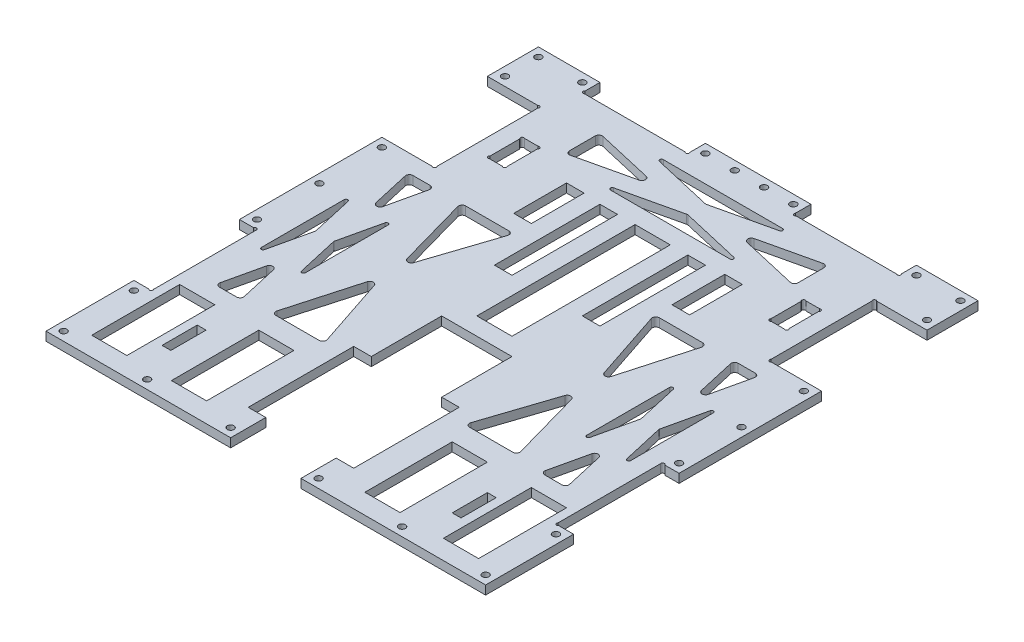
from build123d import *

# Parameters (mm, degrees)
SKETCH1_W           = 317.5
SKETCH1_H           = 355.6
BOSS_EXTRUDE1_DEPTH = 6.35
SKETCH2_W           = 50.8
SKETCH2_H           = 152.4
CUT_EXTRUDE1_DEPTH  = 239.442288615
SKETCH3_W           = 25.4
SKETCH3_H           = 76.2
SKETCH3_W_2         = 12.7
SKETCH3_H_2         = 25.4
CUT_EXTRUDE2_DEPTH  = 239.442288615
SKETCH4_W           = 12.7
SKETCH4_H           = 76.2
SKETCH4_W_2         = 76.2
SKETCH4_H_2         = 12.7
CUT_EXTRUDE3_DEPTH  = 239.442288615
SKETCH5_W           = 25.4
SKETCH5_H           = 63.089423232
SKETCH5_H_2         = 114.3
SKETCH5_W_2         = 12.7
SKETCH5_H_3         = 38.1
SKETCH5_H_4         = 63.5
SKETCH5_W_3         = 6.35
SKETCH5_H_5         = 25.4
CUT_EXTRUDE4_DEPTH  = 239.442288615
SKETCH7_R           = 2.413
CUT_EXTRUDE6_DEPTH  = 239.442288615
SKETCH8_R           = 1.27
CUT_EXTRUDE7_DEPTH  = 239.442288615
FILLET1_R           = 1.27
FILLET2_R           = 2.54


with BuildPart() as part:
    # Sketch1 → Boss-Extrude1 (new body)
    with BuildSketch(Plane(origin=(0, 0, 0), x_dir=(1, 0, 0), z_dir=(0, 1, 0))):
        Rectangle(SKETCH1_W, SKETCH1_H)
    extrude(amount=BOSS_EXTRUDE1_DEPTH)

    # Sketch2 → Cut-Extrude1 (cut, through all)
    with BuildSketch(Plane(origin=(0, 6.35, 0), x_dir=(1, 0, 0), z_dir=(0, 1, 0))):
        with Locations((0, -101.6)):
            Rectangle(SKETCH2_W, SKETCH2_H)
    extrude(amount=-CUT_EXTRUDE1_DEPTH, mode=Mode.SUBTRACT)

    # Sketch3 → Cut-Extrude2 (cut, through all)
    with BuildSketch(Plane(origin=(0, 6.35, 0), x_dir=(1, 0, 0), z_dir=(0, 1, 0))):
        with Locations((133.35, 102.87)):
            Rectangle(SKETCH3_W, SKETCH3_H)
        with Locations((101.6, 102.87)):
            Rectangle(SKETCH3_W_2, SKETCH3_H_2)
        with Locations((-101.6, 102.87)):
            Rectangle(SKETCH3_W_2, SKETCH3_H_2)
        with Locations((-133.35, 102.87)):
            Rectangle(SKETCH3_W, SKETCH3_H)
    extrude(amount=-CUT_EXTRUDE2_DEPTH, mode=Mode.SUBTRACT)

    # Sketch4 → Cut-Extrude3 (cut, through all)
    with BuildSketch(Plane(origin=(0, 6.35, 0), x_dir=(1, 0, 0), z_dir=(0, 1, 0))):
        with Locations((-152.4, 102.87)):
            Rectangle(SKETCH4_W, SKETCH4_H)
        with Locations((-152.4, -76.2)):
            Rectangle(SKETCH4_W, SKETCH4_H)
        with Locations((152.4, 102.87)):
            Rectangle(SKETCH4_W, SKETCH4_H)
        with Locations((152.4, -76.2)):
            Rectangle(SKETCH4_W, SKETCH4_H)
        with Locations((76.2, 171.45)):
            Rectangle(SKETCH4_W_2, SKETCH4_H_2)
        with Locations((-76.2, 171.45)):
            Rectangle(SKETCH4_W_2, SKETCH4_H_2)
        with Locations((-31.75, -114.3)):
            Rectangle(SKETCH4_W, SKETCH4_H)
        with Locations((31.75, 63.5)):
            Rectangle(SKETCH4_W, SKETCH4_H)
        with Locations((-31.75, 63.5)):
            Rectangle(SKETCH4_W, SKETCH4_H)
        with Locations((31.75, -114.3)):
            Rectangle(SKETCH4_W, SKETCH4_H)
    extrude(amount=-CUT_EXTRUDE3_DEPTH, mode=Mode.SUBTRACT)

    # Sketch5 → Cut-Extrude4 (cut, through all)
    with BuildSketch(Plane(origin=(0, 6.35, 0), x_dir=(1, 0, 0), z_dir=(0, 1, 0))):
        with Locations((-69.85, -131.874711616)):
            Rectangle(SKETCH5_W, SKETCH5_H)
        Polygon((-117.475, -46.432505999), (-126.838066818, -87.63), (-108.111933182, -87.63), align=None)
        Polygon((-133.35, 23.417494001), (-133.35, -58.977494001), (-123.986933182, -17.78), align=None)
        Polygon((-101.6, 23.417494001), (-110.963066818, -17.78), (-101.6, -58.977494001), align=None)
        Polygon((-126.838066818, 52.07), (-117.475, 10.872505999), (-108.111933182, 52.07), align=None)
        Polygon((0, 126.833110246), (-54.310144398, 114.3), (54.310144398, 114.3), align=None)
        Polygon((-82.55, 145.883110246), (-82.55, 120.816889754), (-28.239855602, 133.35), align=None)
        Polygon((82.55, 145.883110246), (28.239855602, 133.35), (82.55, 120.816889754), align=None)
        Polygon((-54.310144398, 152.4), (0, 139.866889754), (54.310144398, 152.4), align=None)
        with Locations((0, 44.45)):
            Rectangle(SKETCH5_W, SKETCH5_H_2)
        with Locations((-57.15, 83.82)):
            Rectangle(SKETCH5_W_2, SKETCH5_H_3)
        with Locations((57.15, 83.82)):
            Rectangle(SKETCH5_W_2, SKETCH5_H_3)
        with Locations((-127, -132.08)):
            Rectangle(SKETCH5_W, SKETCH5_H_4)
        Polygon((-71.4375, -22.791352996), (-88.9, -84.952705992), (-50.8, -84.952705992), align=None)
        with Locations((-104.775, -132.08)):
            Rectangle(SKETCH5_W_3, SKETCH5_H_5)
        Polygon((-50.8, 52.07), (-88.9, 52.07), (-71.4375, -10.091352996), align=None)
    cut_extrude4 = extrude(amount=-CUT_EXTRUDE4_DEPTH, mode=Mode.SUBTRACT)

    # Mirror1: Cut-Extrude4 across plane
    add(cut_extrude4.mirror(Plane(origin=(0, 0, 0), x_dir=(0, 0, 1), z_dir=(1, 0, 0))), mode=Mode.SUBTRACT)

    # Sketch7 → Cut-Extrude6 (cut, through all)
    with BuildSketch(Plane(origin=(0, 6.35, 0), x_dir=(1, 0, 0), z_dir=(0, 1, 0))):
        with Locations((-152.4, -171.45)):
            Circle(SKETCH7_R)
        with Locations((-152.4, 171.45)):
            Circle(SKETCH7_R)
        with Locations((-120.65, 171.45)):
            Circle(SKETCH7_R)
        with Locations((-152.4, 147.32)):
            Circle(SKETCH7_R)
        with Locations((-31.75, 171.45)):
            Circle(SKETCH7_R)
        with Locations((-10.583333333, 171.45)):
            Circle(SKETCH7_R)
        with Locations((10.583333333, 171.45)):
            Circle(SKETCH7_R)
        with Locations((31.75, 171.45)):
            Circle(SKETCH7_R)
        with Locations((-31.75, -171.45)):
            Circle(SKETCH7_R)
        with Locations((-92.075, -171.45)):
            Circle(SKETCH7_R)
        with Locations((-152.4, -120.65)):
            Circle(SKETCH7_R)
        with Locations((-152.4, -31.75)):
            Circle(SKETCH7_R)
        with Locations((-152.4, 58.42)):
            Circle(SKETCH7_R)
        with Locations((-152.4, 13.335)):
            Circle(SKETCH7_R)
        with Locations((31.75, -171.45)):
            Circle(SKETCH7_R)
        with Locations((152.4, 13.335)):
            Circle(SKETCH7_R)
        with Locations((152.4, 58.42)):
            Circle(SKETCH7_R)
        with Locations((152.4, -31.75)):
            Circle(SKETCH7_R)
        with Locations((152.4, -120.65)):
            Circle(SKETCH7_R)
        with Locations((92.075, -171.45)):
            Circle(SKETCH7_R)
        with Locations((152.4, 147.32)):
            Circle(SKETCH7_R)
        with Locations((120.65, 171.45)):
            Circle(SKETCH7_R)
        with Locations((152.4, 171.45)):
            Circle(SKETCH7_R)
        with Locations((152.4, -171.45)):
            Circle(SKETCH7_R)
    extrude(amount=-CUT_EXTRUDE6_DEPTH, mode=Mode.SUBTRACT)

    # Sketch8 → Cut-Extrude7 (cut, through all)
    with BuildSketch(Plane(origin=(0, 6.35, 0), x_dir=(1, 0, 0), z_dir=(0, 1, 0))):
        with Locations((-39.09938383, 165.88366572)):
            Circle(SKETCH8_R)
        with Locations((-113.539841326, 166.117378391)):
            Circle(SKETCH8_R)
        with Locations((-121.560019166, 140.084130304)):
            Circle(SKETCH8_R)
        with Locations((-121.565556473, 65.650145639)):
            Circle(SKETCH8_R)
        with Locations((-147.253032713, -38.506954901)):
            Circle(SKETCH8_R)
        with Locations((-147.044413998, -113.510037468)):
            Circle(SKETCH8_R)
        with Locations((-107.194291917, 114.549311364)):
            Circle(SKETCH8_R)
        with Locations((-96.034081321, 114.570942203)):
            Circle(SKETCH8_R)
        with Locations((-107.184450657, 91.18332828)):
            Circle(SKETCH8_R)
        with Locations((-96.208355861, 91.003339093)):
            Circle(SKETCH8_R)
    cut_extrude7 = extrude(amount=-CUT_EXTRUDE7_DEPTH, mode=Mode.SUBTRACT)

    # Mirror2: Cut-Extrude7 across plane
    add(cut_extrude7.mirror(Plane(origin=(0, 0, 0), x_dir=(0, 0, 1), z_dir=(1, 0, 0))), mode=Mode.SUBTRACT)

    # Fillet1
    fillet1_edges = [part.edges().sort_by_distance(p)[0] for p in [
        (-101.6, 3.175, 58.977494001),
        (-110.963066818, 3.175, 17.78),
        (-101.6, 3.175, -23.417494001),
        (-133.35, 3.175, -23.417494001),
        (-123.986933182, 3.175, 17.78),
        (-133.35, 3.175, 58.977494001),
        (133.35, 3.175, -23.417494001),
        (133.35, 3.175, 58.977494001),
        (123.986933182, 3.175, 17.78),
        (101.6, 3.175, -23.417494001),
        (110.963066818, 3.175, 17.78),
        (101.6, 3.175, 58.977494001),
        (54.310144398, 3.175, -152.4),
        (-54.310144398, 3.175, -152.4),
        (54.310144398, 3.175, -114.3),
        (-54.310144398, 3.175, -114.3),
    ]]
    fillet(fillet1_edges, radius=FILLET1_R)

    # Fillet2
    fillet2_edges = [part.edges().sort_by_distance(p)[0] for p in [
        (-126.838066818, 3.175, 87.63),
        (-108.111933182, 3.175, 87.63),
        (-117.475, 3.175, 46.432505999),
        (-28.239855602, 3.175, -133.35),
        (-82.55, 3.175, -120.816889754),
        (-82.55, 3.175, -145.883110246),
        (-88.9, 3.175, -52.07),
        (-71.4375, 3.175, 10.091352996),
        (-50.8, 3.175, -52.07),
        (-71.4375, 3.175, 22.791352996),
        (-88.9, 3.175, 84.952705992),
        (-50.8, 3.175, 84.952705992),
        (-126.838066818, 3.175, -52.07),
        (-117.475, 3.175, -10.872505999),
        (-108.111933182, 3.175, -52.07),
        (126.838066818, 3.175, 87.63),
        (108.111933182, 3.175, 87.63),
        (117.475, 3.175, 46.432505999),
        (88.9, 3.175, 84.952705992),
        (50.8, 3.175, 84.952705992),
        (71.4375, 3.175, 22.791352996),
        (117.475, 3.175, -10.872505999),
        (108.111933182, 3.175, -52.07),
        (126.838066818, 3.175, -52.07),
        (71.4375, 3.175, 10.091352996),
        (88.9, 3.175, -52.07),
        (50.8, 3.175, -52.07),
        (28.239855602, 3.175, -133.35),
        (82.55, 3.175, -120.816889754),
        (82.55, 3.175, -145.883110246),
        (0, 3.175, -139.866889754),
        (0, 3.175, -126.833110246),
    ]]
    fillet(fillet2_edges, radius=FILLET2_R)


solid = part.part
